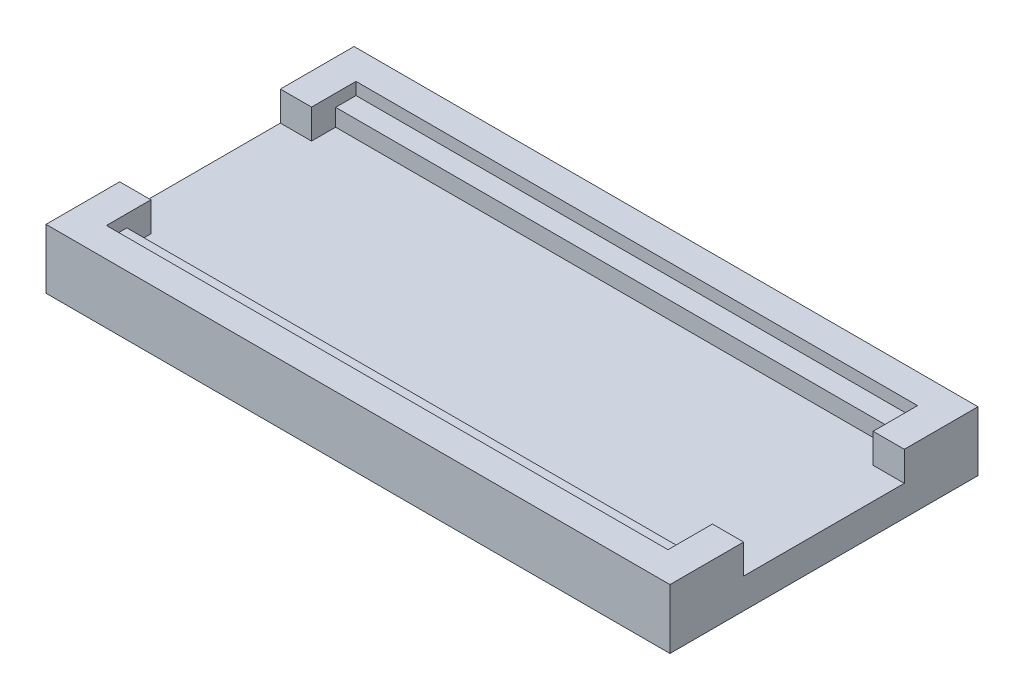
from build123d import *

# Parameters (mm, degrees)
SKETCH1_W           = 254
SKETCH1_H           = 125.4
BOSS_EXTRUDE1_DEPTH = 24.3
SKETCH2_W           = 228.6
SKETCH2_H           = 101.6
CUT_EXTRUDE1_DEPTH  = 5
SKETCH3_W           = 228.6
SKETCH3_H           = 85
CUT_EXTRUDE2_DEPTH  = 7
SKETCH4_W           = 12.7
SKETCH4_H           = 65.4
CUT_EXTRUDE3_DEPTH  = 12
SKETCH5_W           = 12.7
SKETCH5_H           = 65.4
CUT_EXTRUDE4_DEPTH  = 12


with BuildPart() as part:
    # Sketch1 → Boss-Extrude1 (new body)
    with BuildSketch(Plane(origin=(0, 0, 0), x_dir=(1, 0, 0), z_dir=(0, 1, 0))):
        with Locations((127, 62.7)):
            Rectangle(SKETCH1_W, SKETCH1_H)
    extrude(amount=BOSS_EXTRUDE1_DEPTH)

    # Sketch2 → Cut-Extrude1 (cut)
    with BuildSketch(Plane(origin=(0, 24.3, 0), x_dir=(1, 0, 0), z_dir=(0, 1, 0))):
        with Locations((127, 62.7)):
            Rectangle(SKETCH2_W, SKETCH2_H)
    extrude(amount=-CUT_EXTRUDE1_DEPTH, mode=Mode.SUBTRACT)

    # Sketch3 → Cut-Extrude2 (cut)
    with BuildSketch(Plane(origin=(0, 19.3, 0), x_dir=(1, 0, 0), z_dir=(0, 1, 0))):
        with Locations((127, 62.7)):
            Rectangle(SKETCH3_W, SKETCH3_H)
    extrude(amount=-CUT_EXTRUDE2_DEPTH, mode=Mode.SUBTRACT)

    # Sketch4 → Cut-Extrude3 (cut)
    with BuildSketch(Plane(origin=(0, 24.3, 0), x_dir=(1, 0, 0), z_dir=(0, 1, 0))):
        with Locations((6.35, 62.7)):
            Rectangle(SKETCH4_W, SKETCH4_H)
    extrude(amount=-CUT_EXTRUDE3_DEPTH, mode=Mode.SUBTRACT)

    # Sketch5 → Cut-Extrude4 (cut)
    with BuildSketch(Plane(origin=(0, 24.3, 0), x_dir=(1, 0, 0), z_dir=(0, 1, 0))):
        with Locations((247.65, 62.7)):
            Rectangle(SKETCH5_W, SKETCH5_H)
    extrude(amount=-CUT_EXTRUDE4_DEPTH, mode=Mode.SUBTRACT)


solid = part.part
